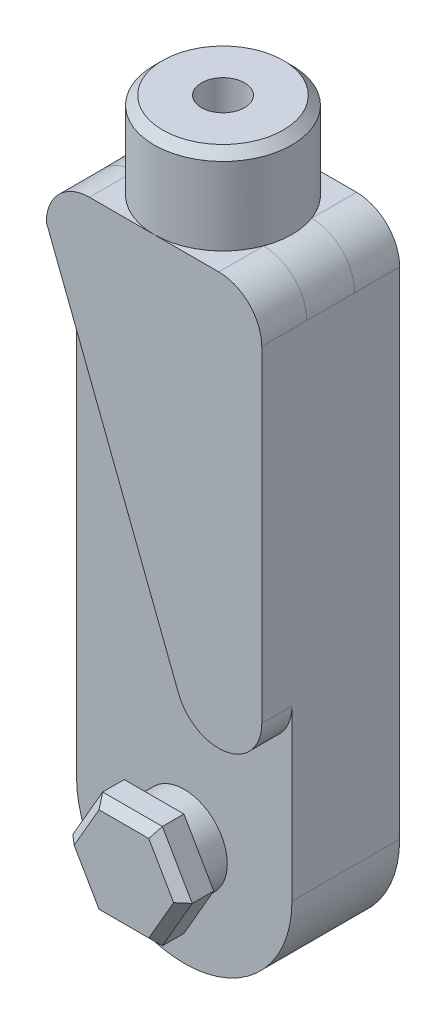
from build123d import *

# Parameters (mm, degrees)
CROQUIS1_W              = 25
CROQUIS1_H              = 12.5
SALIENTE_EXTRUIR2_DEPTH = 16
CORTAR_EXTRUIR3_START   = -3.5
CROQUIS2_R              = 12.5
CROQUIS2_R_2            = 5
CORTAR_EXTRUIR3_DEPTH   = 3.5
REDONDEO5_R             = 5
REDONDEO6_R             = 5
SALIENTE_EXTRUIR3_DEPTH = 3.5
CHAFL_N1_SIZE           = 1
CHAFL_N2_SIZE           = 1
CHAFL_N3_SIZE           = 1
CHAFL_N4_SIZE           = 1
CHAFL_N5_SIZE           = 1
CHAFL_N6_SIZE           = 1
CORTAR_EXTRUIR5_DEPTH   = 10
REDONDEO9_R             = 5
REDONDEO10_R            = 5
CROQUIS5_R              = 2.5
CORTAR_EXTRUIR6_DEPTH   = 5
CORTAR_EXTRUIR9_START   = -3.5
CORTAR_EXTRUIR9_DEPTH   = 3.5
REDONDEO12_START        = 12.5
REDONDEO12_DEPTH        = 4.5


with BuildPart() as part:
    # Croquis1 → Saliente-Extruir2 (new body)
    with BuildSketch(Plane.XY):
        with Locations((0, 36.25)):
            Rectangle(CROQUIS1_W, CROQUIS1_H)
        with Locations((0, 23.75)):
            Rectangle(CROQUIS1_W, CROQUIS1_H)
        with BuildLine():
            Line((-12.5, 17.5), (-12.5, -30))
            ThreePointArc((-12.5, -30), (0, -17.5), (12.5, -30))
            Line((12.5, -30), (12.5, 17.5))
            Line((12.5, 17.5), (-12.5, 17.5))
        make_face()
        with BuildLine():
            ThreePointArc((12.5, -30), (0, -17.5), (-12.5, -30))
            Line((-12.5, -30), (12.5, -30))
        make_face()
        with BuildLine():
            Line((12.5, -30), (-12.5, -30))
            ThreePointArc((-12.5, -30), (0, -42.5), (12.5, -30))
        make_face()
    extrude(amount=SALIENTE_EXTRUIR2_DEPTH)

    # Croquis2 → Cortar-Extruir3 (cut)
    with BuildSketch(Plane.XY.offset(16).offset(CORTAR_EXTRUIR3_START)):
        with Locations((0, -30)):
            Circle(CROQUIS2_R)
        with Locations((0, -30)):
            Circle(CROQUIS2_R_2, mode=Mode.SUBTRACT)
    extrude(amount=CORTAR_EXTRUIR3_DEPTH, mode=Mode.SUBTRACT)

    # Redondeo5
    redondeo5_edges = [part.edges().sort_by_distance(p)[0] for p in [
        (-12.5, -30, 14.25),
    ]]
    fillet(redondeo5_edges, radius=REDONDEO5_R)

    # Redondeo6
    redondeo6_edges = [part.edges().sort_by_distance(p)[0] for p in [
        (12.5, -30, 14.25),
    ]]
    fillet(redondeo6_edges, radius=REDONDEO6_R)

    # Croquis3 → Saliente-Extruir3 (add)
    with BuildSketch(Plane.XY.offset(16)):
        Polygon((6.92820323, -30), (3.464101615, -24), (-3.464101615, -24), (-6.92820323, -30), (-3.464101615, -36), (3.464101615, -36), align=None)
    extrude(amount=SALIENTE_EXTRUIR3_DEPTH)

    # Chaflán1
    chafl_n1_edges = [part.edges().sort_by_distance(p)[0] for p in [
        (5.196152423, -27, 19.5),
    ]]
    chamfer(chafl_n1_edges, length=CHAFL_N1_SIZE)

    # Chaflán2
    chafl_n2_edges = [part.edges().sort_by_distance(p)[0] for p in [
        (-0.577350269, -24, 19.5),
    ]]
    chamfer(chafl_n2_edges, length=CHAFL_N2_SIZE)

    # Chaflán3
    chafl_n3_edges = [part.edges().sort_by_distance(p)[0] for p in [
        (4.907477288, -33.5, 19.5),
    ]]
    chamfer(chafl_n3_edges, length=CHAFL_N3_SIZE)

    # Chaflán4
    chafl_n4_edges = [part.edges().sort_by_distance(p)[0] for p in [
        (-0.577350269, -36, 19.5),
    ]]
    chamfer(chafl_n4_edges, length=CHAFL_N4_SIZE)

    # Chaflán5
    chafl_n5_edges = [part.edges().sort_by_distance(p)[0] for p in [
        (-5.484827557, -32.5, 19.5),
    ]]
    chamfer(chafl_n5_edges, length=CHAFL_N5_SIZE)

    # Chaflán6
    chafl_n6_edges = [part.edges().sort_by_distance(p)[0] for p in [
        (-5.196152423, -27, 19.5),
    ]]
    chamfer(chafl_n6_edges, length=CHAFL_N6_SIZE)

    # Croquis4 → Cortar-Extruir5 (cut)
    with BuildSketch(Plane(origin=(0, 42.5, 0), x_dir=(1, 0, 0), z_dir=(0, 1, 0))):
        with BuildLine():
            ThreePointArc((-8, -8), (-5.656854249, -2.343145751), (0, 0))
            Line((0, 0), (-12.5, 0))
            Line((-12.5, 0), (-12.5, -8))
            Line((-12.5, -8), (-8, -8))
        make_face()
        with BuildLine():
            ThreePointArc((0, -16), (-5.656854249, -13.656854249), (-8, -8))
            Line((-8, -8), (-12.5, -8))
            Line((-12.5, -8), (-12.5, -16))
            Line((-12.5, -16), (0, -16))
        make_face()
        with BuildLine():
            Line((12.5, -8), (8, -8))
            ThreePointArc((8, -8), (5.656854249, -13.656854249), (0, -16))
            Line((0, -16), (12.5, -16))
            Line((12.5, -16), (12.5, -8))
        make_face()
        with BuildLine():
            Line((12.5, 0), (0, 0))
            ThreePointArc((0, 0), (5.656854249, -2.343145751), (8, -8))
            Line((8, -8), (12.5, -8))
            Line((12.5, -8), (12.5, 0))
        make_face()
    extrude(amount=-CORTAR_EXTRUIR5_DEPTH, mode=Mode.SUBTRACT)

    # Redondeo9
    redondeo9_edges = [part.edges().sort_by_distance(p)[0] for p in [
        (12.5, 32.5, 8),
    ]]
    fillet(redondeo9_edges, radius=REDONDEO9_R)

    # Redondeo10
    redondeo10_edges = [part.edges().sort_by_distance(p)[0] for p in [
        (-12.5, 32.5, 8),
    ]]
    fillet(redondeo10_edges, radius=REDONDEO10_R)

    # Croquis5 → Cortar-Extruir6 (cut)
    with BuildSketch(Plane(origin=(0, 42.5, 0), x_dir=(1, 0, 0), z_dir=(0, 1, 0))):
        with Locations(Location((0, -8, 0), (0, 0, 270))):
            Circle(CROQUIS5_R)
    extrude(amount=-CORTAR_EXTRUIR6_DEPTH, mode=Mode.SUBTRACT)

    # Chaflán7: read off the stored shape, not the designer's step
    # Chaflán7 outline → Chaflán7 (revolve, cut)
    with BuildSketch(Plane.XY.offset(8)):
        Polygon((8, 42.5), (7, 42.5), (8, 41.5), align=None)
    revolve(axis=Axis((0, 0, 8), (0, 1, 0)), mode=Mode.SUBTRACT)

    # Croquis7 → Cortar-Extruir9 (cut)
    with BuildSketch(Plane.XY.offset(16).offset(CORTAR_EXTRUIR9_START)):
        with BuildLine():
            Line((-12.5, 27.5), (5.357142857, -18.706151214))
            ThreePointArc((5.357142857, -18.706151214), (0, -17.5), (-5.357142857, -18.706151214))
            ThreePointArc((-5.357142857, -18.706151214), (-10.172612419, -18.414382973), (-12.5, -14.188611699))
            Line((-12.5, -14.188611699), (-12.5, 27.5))
        make_face()
    extrude(amount=CORTAR_EXTRUIR9_DEPTH, mode=Mode.SUBTRACT)

    # Redondeo12: read off the stored shape, not the designer's step
    # Redondeo12 outline → Redondeo12 (cut)
    with BuildSketch(Plane.XY.offset(REDONDEO12_START)):
        with BuildLine():
            ThreePointArc((12.5, -10.380609645), (8.416748435, -15.29584843), (2.836171077, -12.18302463))
            Line((2.836171077, -12.18302463), (5.357142857, -18.706151214))
            ThreePointArc((5.357142857, -18.706151214), (10.172612419, -18.414382973), (12.5, -14.188611699))
            Line((12.5, -14.188611699), (12.5, -10.380609645))
        make_face()
    extrude(amount=REDONDEO12_DEPTH, mode=Mode.SUBTRACT)


solid = part.part
